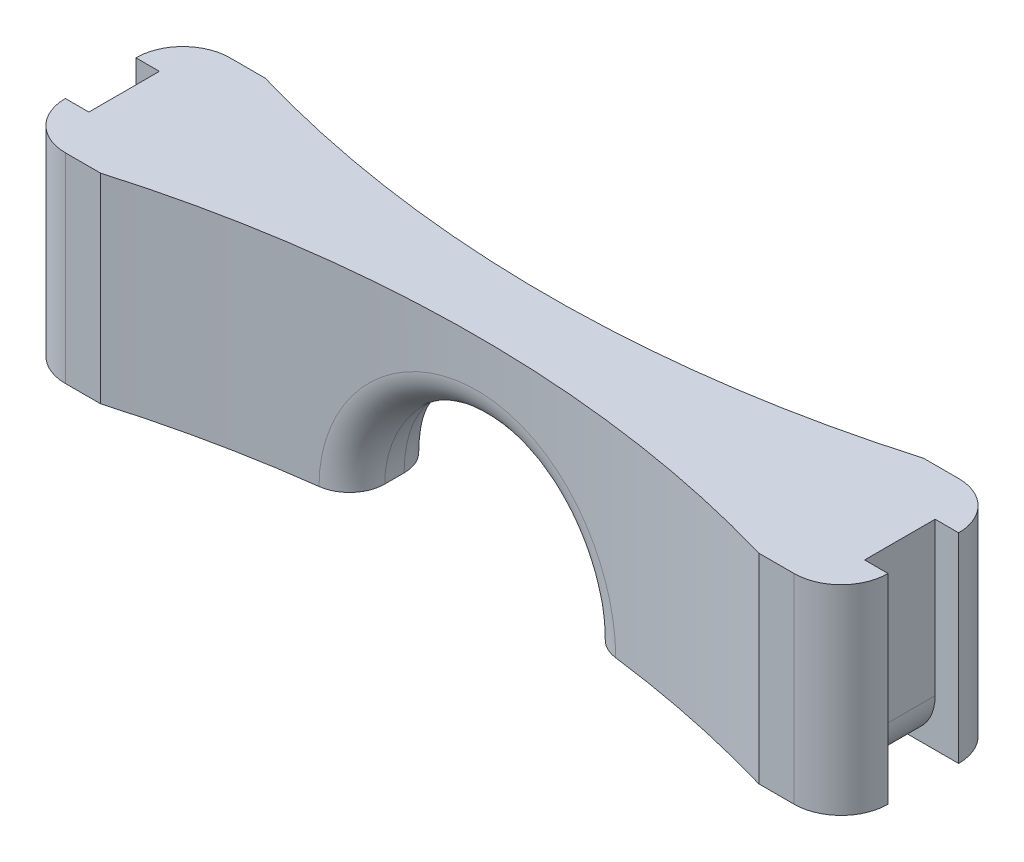
from build123d import *

# Parameters (mm, degrees)
BOSS_EXTRUDE1_DEPTH = 7
SKETCH2_R           = 50
SKETCH2_W           = 6.441902201
SKETCH2_H           = 3
SKETCH2_W_2         = 5.266935295
CUT_EXTRUDE1_DEPTH  = 37.691279618
FILLET1_R           = 2
FILLET2_R           = 1.5


with BuildPart() as part:
    # Sketch1 → Boss-Extrude1 (new body)
    with BuildSketch(Plane.XY):
        with BuildLine():
            Line((0, 0), (12.5, 0))
            ThreePointArc((12.5, 0), (17.5, 5), (22.5, 0))
            Line((22.5, 0), (35, 0))
            Line((35, 0), (35, 8.5))
            Line((35, 8.5), (0, 8.5))
            Line((0, 8.5), (0, 0))
        make_face()
    extrude(amount=BOSS_EXTRUDE1_DEPTH)

    # Sketch2 → Cut-Extrude1 (cut, through all)
    with BuildSketch(Plane(origin=(0, 8.5, 0), x_dir=(1, 0, 0), z_dir=(0, 1, 0))):
        with Locations((17.5, 48)):
            Circle(SKETCH2_R)
        with Locations((17.5, -55)):
            Circle(SKETCH2_R)
        with Locations((37.220951101, -3.5)):
            Rectangle(SKETCH2_W, SKETCH2_H)
        with Locations((-1.633467648, -3.5)):
            Rectangle(SKETCH2_W_2, SKETCH2_H)
    extrude(amount=-CUT_EXTRUDE1_DEPTH, mode=Mode.SUBTRACT)

    # Fillet1
    fillet1_edges = [part.edges().sort_by_distance(p)[0] for p in [
        (35, 4.25, 0),
        (35, 4.25, 7),
        (0, 4.25, 7),
        (0, 4.25, 0),
        (1, 0, 3.5),
        (34, 0, 3.5),
    ]]
    fillet(fillet1_edges, radius=FILLET1_R - 0.0001)  # a hair under: the kernel refuses the full size

    # Fillet2
    fillet2_edges = [part.edges().sort_by_distance(p)[0] for p in [
        (17.48803644, 4.999985682, 1.999998553),
        (17.48803647, 4.999985682, 5.000001447),
    ]]
    fillet(fillet2_edges, radius=FILLET2_R - 0.0001)  # a hair under: the kernel refuses the full size


solid = part.part
